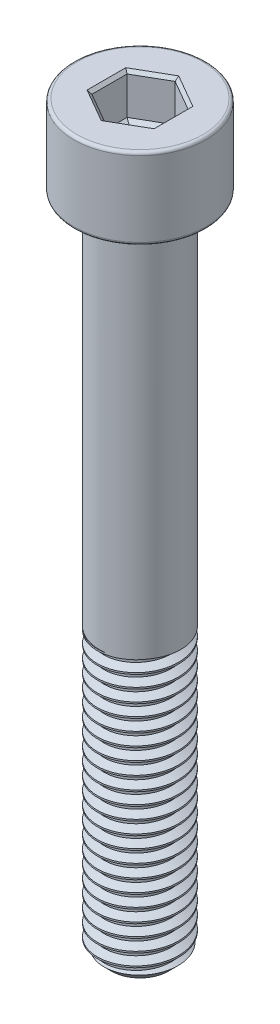
from build123d import *

# Parameters (mm, degrees)
SKETCH1_R           = 4
BOSS_EXTRUDE1_DEPTH = 28
THREAD1_PITCH       = 1.25
SKETCH2_R           = 4
BOSS_EXTRUDE2_DEPTH = 37
SKETCH5_R           = 6.5
BOSS_EXTRUDE3_DEPTH = 8
FILLET1_R           = 0.3
CUT_EXTRUDE1_DEPTH  = 4
CHAMFER1_SIZE       = 0.3
CUT_EXTRUDE2_DEPTH  = 0.4
CUT_EXTRUDE2_DRAFT  = -60


with BuildPart() as part:
    # Sketch1 → Boss-Extrude1 (new body)
    with BuildSketch(Plane(origin=(0, 0, 0), x_dir=(1, 0, 0), z_dir=(0, 1, 0))):
        with Locations(Location((0, 0, 0), (0, 0, 270))):
            Circle(SKETCH1_R)
    extrude(amount=BOSS_EXTRUDE1_DEPTH)

    # Thread1: the profile of Thread Profile1 profile screwed along a right-hand helix of 24 turns, 8 arcs to a turn; built about Z, then put on its axis
    thread1_z = Axis((0, 0, 0), (0, 0, 1))
    thread1_corners = [(4.0003, 0, -0.000173205), (4.0003, 0, 1.093923202), (3.323417656, 0, 0.703124998), (3.323417656, 0, 0.390624998)]
    with BuildLine(mode=Mode.PRIVATE) as thread1_profile:
        Line(thread1_corners[0], thread1_corners[1])
        Line(thread1_corners[1], thread1_corners[2])
        Line(thread1_corners[2], thread1_corners[3])
        Line(thread1_corners[3], thread1_corners[0])
    thread1_cap = Face(thread1_profile.wire())
    thread1_turn_angles = [0, 22.5, 45, 67.5, 90, 112.5, 135, 157.5, 180, 202.5, 225, 247.5, 270, 292.5, 315, 337.5, 360]
    thread1_turn_weights = [1, 0.9238795325112867, 1, 0.9238795325112867, 1, 0.9238795325112867, 1, 0.9238795325112867, 1, 0.9238795325112867, 1, 0.9238795325112867, 1, 0.9238795325112867, 1, 0.9238795325112867, 1]
    thread1_turn_rails = [Edge.make_bspline([Vector(p[0], p[1], 0).rotate(thread1_z, thread1_turn_angles[k]) / thread1_turn_weights[k] + Vector(0, 0, p[2] + THREAD1_PITCH * thread1_turn_angles[k] / 360) for k in range(17)], [0, 0, 0, 1, 1, 2, 2, 3, 3, 4, 4, 5, 5, 6, 6, 7, 7, 8, 8, 8], 2, thread1_turn_weights) for p in thread1_corners]
    thread1_turn_sides = [Face.make_surface_from_curves(thread1_turn_rails[p[0]], thread1_turn_rails[p[1]]) for p in [(0, 1), (1, 2), (2, 3), (3, 0)]]
    thread1 = Plane(origin=(0, 30, 0), x_dir=(-1, 0, 0), z_dir=(0, -1, 0)) * Solid(Shell([*[p.moved(Location((0, 0, THREAD1_PITCH * i))) for i in range(24) for p in thread1_turn_sides], thread1_cap, thread1_cap.rotate(thread1_z, 8640).moved(Location((0, 0, THREAD1_PITCH * 8640 / 360)))]))
    add(thread1, mode=Mode.SUBTRACT)

    # Sketch2 → Boss-Extrude2 (add)
    with BuildSketch(Plane(origin=(0, 28, 0), x_dir=(1, 0, 0), z_dir=(0, 1, 0))):
        with Locations(Location((0, 0, 0), (0, 0, 117.593571361))):
            Circle(SKETCH2_R)
    extrude(amount=BOSS_EXTRUDE2_DEPTH)

    # Sketch5 → Boss-Extrude3 (add)
    with BuildSketch(Plane(origin=(0, 65, 0), x_dir=(1, 0, 0), z_dir=(0, 1, 0))):
        with Locations(Location((0, 0, 0), (0, 0, 270))):
            Circle(SKETCH5_R)
    extrude(amount=BOSS_EXTRUDE3_DEPTH)

    # Sketch6 → Cut-Revolve1 (revolve, cut)
    with BuildSketch(Plane.XY, mode=Mode.PRIVATE) as cut_revolve1_sk:
        Polygon((4.01, 0), (4.01, 1.2), (2.81, 0), align=None)
    revolve(cut_revolve1_sk.sketch.rotate(Axis((0, 0, 0), (0, 1, 0)), 117.593571361), axis=Axis((0, 0, 0), (0, 1, 0)), mode=Mode.SUBTRACT)

    # Fillet1
    fillet1_edges = [part.edges().sort_by_distance(p)[0] for p in [
        (0, 65, -6.5),
        (0, 73, -6.5),
    ]]
    fillet(fillet1_edges, radius=FILLET1_R)

    # Sketch7 → Cut-Extrude1 (cut)
    with BuildSketch(Plane(origin=(0, 73, 0), x_dir=(1, 0, 0), z_dir=(0, 1, 0))):
        Polygon((0, 3.464101615), (-3, 1.732050808), (-3, -1.732050808), (0, -3.464101615), (3, -1.732050808), (3, 1.732050808), align=None)
    extrude(amount=-CUT_EXTRUDE1_DEPTH, mode=Mode.SUBTRACT)

    # Chamfer1
    chamfer1_edges = [part.edges().sort_by_distance(p)[0] for p in [
        (1.5, 73, -2.598076211),
        (-1.5, 73, -2.598076211),
        (-3, 73, 0),
        (-1.5, 73, 2.598076211),
        (1.5, 73, 2.598076211),
        (3, 73, 0),
    ]]
    chamfer(chamfer1_edges, length=CHAMFER1_SIZE)


with BuildPart() as cut_extrude2_tool:
    # Sketch8 → Cut-Extrude2 (with draft: the straight prism first)
    with BuildSketch(Plane(origin=(0, 69, 0), x_dir=(1, 0, 0), z_dir=(0, 1, 0))):
        Polygon((0, 3.464101615), (-3, 1.732050808), (-3, -1.732050808), (0, -3.464101615), (3, -1.732050808), (3, 1.732050808), align=None)
    extrude(amount=-CUT_EXTRUDE2_DEPTH)
    # Cut-Extrude2: the draft: its side faces are tilted about the plane it starts from
    cut_extrude2_sides = [cut_extrude2_tool.faces().sort_by_distance(p)[0] for p in [
        (-1.5, 68.8, -2.598076211),
        (-3, 68.8, 0),
        (-1.5, 68.8, 2.598076211),
        (1.5, 68.8, 2.598076211),
        (3, 68.8, 0),
        (1.5, 68.8, -2.598076211),
    ]]
    draft(cut_extrude2_sides, Plane(origin=(0, 69, 0), x_dir=(1, 0, 0), z_dir=(0, 1, 0)), CUT_EXTRUDE2_DRAFT)


with BuildPart() as part_1:
    add(part.part)

    # Cut-Extrude2: cut by cut_extrude2_tool
    add(cut_extrude2_tool.part, mode=Mode.SUBTRACT)


solid = part_1.part
